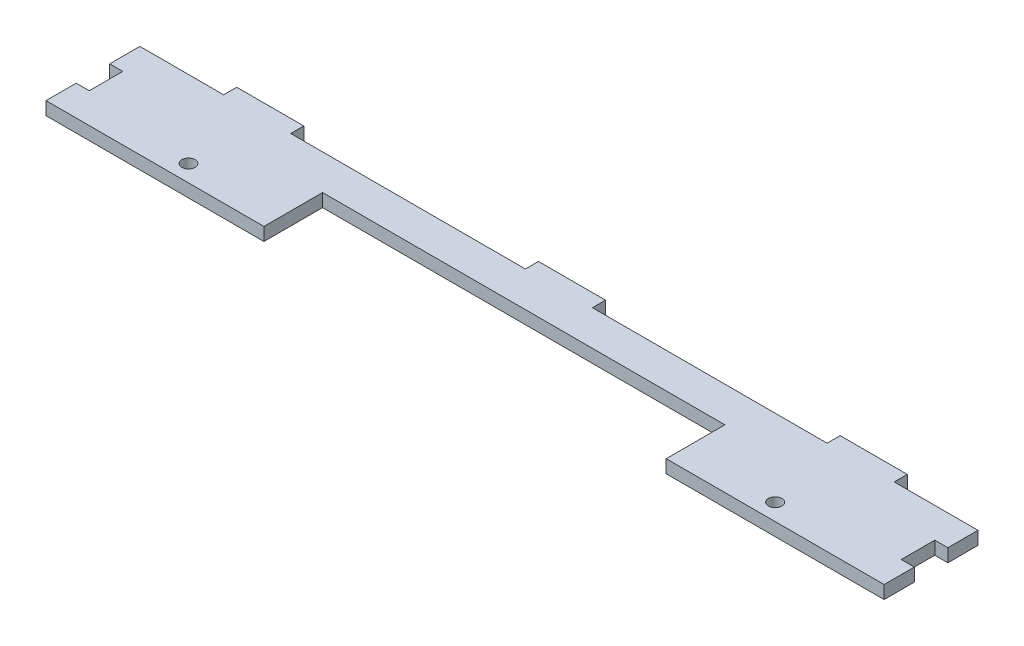
from build123d import *

# Parameters (mm, degrees)
SKETCH1_R           = 2
BOSS_EXTRUDE1_DEPTH = 3.9


with BuildPart() as part:
    # Sketch1 → Boss-Extrude1 (new body)
    with BuildSketch(Plane(origin=(0, 0, 0), x_dir=(1, 0, 0), z_dir=(0, 1, 0))):
        Polygon((-100, 14), (-125, 14), (-125, 5), (-121.1, 5), (-121.1, -5), (-125, -5), (-125, -14), (-60, -14), (-60, 3.5), (60, 3.5), (60, -14), (125, -14), (125, -5), (121.1, -5), (121.1, 5), (125, 5), (125, 14), (100, 14), (100, 17.9), (80, 17.9), (80, 14), (10, 14), (10, 17.9), (-10, 17.9), (-10, 14), (-80, 14), (-80, 17.9), (-100, 17.9), align=None)
        with Locations((-87.5, -9)):
            Circle(SKETCH1_R, mode=Mode.SUBTRACT)
        with Locations((87.5, -9)):
            Circle(SKETCH1_R, mode=Mode.SUBTRACT)
    extrude(amount=BOSS_EXTRUDE1_DEPTH)


solid = part.part
